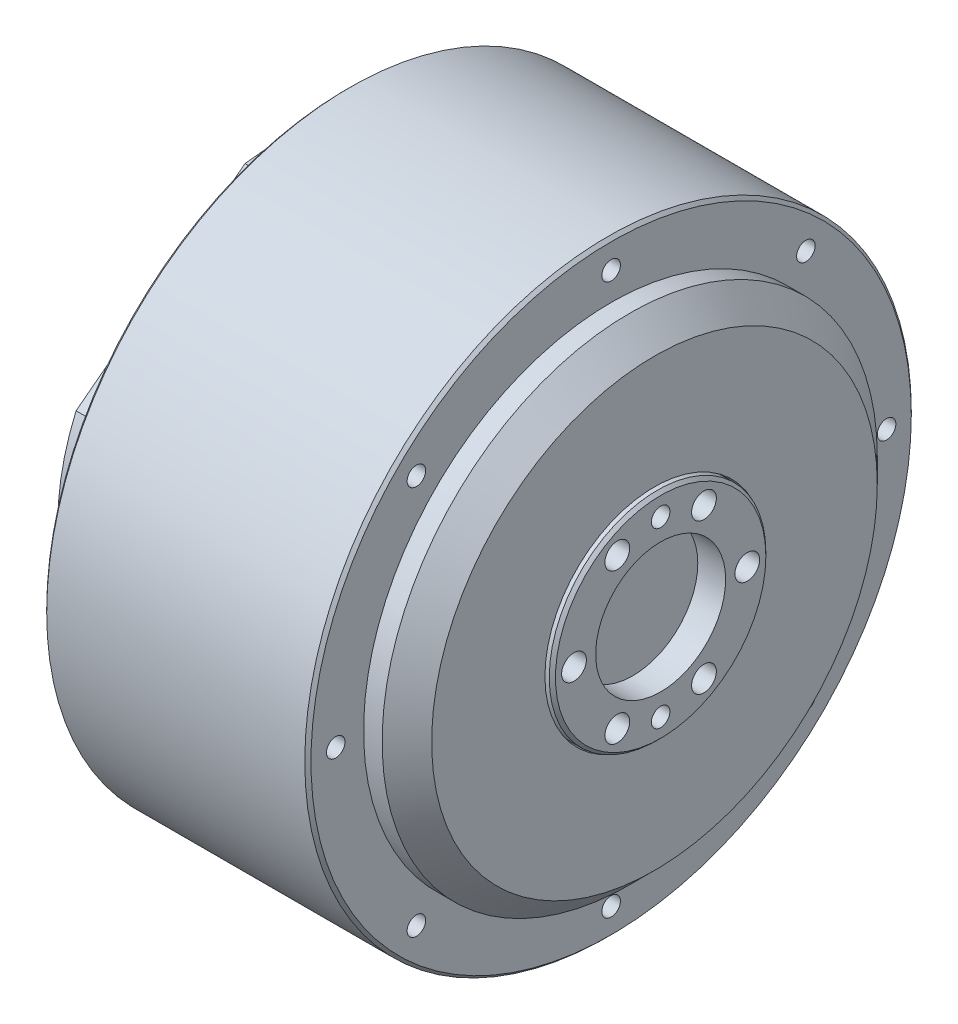
from build123d import *

# Parameters (mm, degrees)
SKETCH1_W                      = 42.7
SKETCH1_H                      = 49
SKETCH2_R                      = 35.5
BOSS_EXTRUDE1_DEPTH            = 11.2
CUT_EXTRUDE1_START             = -8
CUT_EXTRUDE1_DEPTH             = 8
SKETCH4_R                      = 40
BOSS_EXTRUDE2_DEPTH            = 3
SKETCH5_R                      = 40
BOSS_EXTRUDE3_DEPTH            = 4
BOSS_EXTRUDE3_TAPER            = 45.000000001
M33_CLEARANCE_HOLE1_D          = 35.4
M33_CLEARANCE_HOLE1_DEPTH      = 7.5
SKETCH8_W                      = 8.5
SKETCH8_H                      = 17.5
F_3_0_3_DIAMETER_HOLE1_D       = 3
F_3_0_3_DIAMETER_HOLE1_DEPTH   = 4
F_3_0_3_DIAMETER_HOLE2_D       = 3
F_3_0_3_DIAMETER_HOLE2_DEPTH   = 8
F_21_0_21_DIAMETER_HOLE1_D     = 21
F_21_0_21_DIAMETER_HOLE1_DEPTH = 4.5
F_4_0_4_DIAMETER_HOLE1_D       = 4
F_4_0_4_DIAMETER_HOLE1_DEPTH   = 8
F_3_0_3_DIAMETER_HOLE3_D       = 3
F_3_0_3_DIAMETER_HOLE3_DEPTH   = 3
CHAMFER1_SIZE                  = 0.5


with BuildPart() as part:
    # Sketch1 → Revolve1 (revolve)
    with BuildSketch(Plane.XY):
        with Locations((-29.35, 24.5)):
            Rectangle(SKETCH1_W, SKETCH1_H)
    revolve(axis=Axis((-50.7, 0, 0), (1, 0, 0)))

    # Sketch2 → Boss-Extrude1 (add)
    with BuildSketch(Plane.ZY.offset(50.7)):
        Circle(SKETCH2_R)
    extrude(amount=BOSS_EXTRUDE1_DEPTH)

    # Sketch3 → Cut-Extrude1 (cut)
    with BuildSketch(Plane.ZY.offset(61.9).offset(CUT_EXTRUDE1_START)):
        with BuildLine():
            Line((5.253044864, 35.109194233), (32.553289394, 14.160979826))
            ThreePointArc((32.553289394, 14.160979826), (21.61103073, 28.16404358), (5.253044864, 35.109194233))
        make_face()
    extrude(amount=CUT_EXTRUDE1_DEPTH, mode=Mode.SUBTRACT)

    # Sketch4 → Boss-Extrude2 (add)
    with BuildSketch(Plane(origin=(-8, 0, 0), x_dir=(0, 0, -1), z_dir=(1, 0, 0))):
        Circle(SKETCH4_R)
    extrude(amount=BOSS_EXTRUDE2_DEPTH)

    # Sketch5 → Boss-Extrude3 (add)
    with BuildSketch(Plane(origin=(-5, 0, 0), x_dir=(0, 0, -1), z_dir=(1, 0, 0))):
        Circle(SKETCH5_R)
    extrude(amount=BOSS_EXTRUDE3_DEPTH, taper=BOSS_EXTRUDE3_TAPER)

    # M33 Clearance Hole1
    with Locations(Plane(origin=(-1, 0, 0), x_dir=(0, 0, -1), z_dir=(1, 0, 0))):
        with Locations((0, 0)):
            Hole(M33_CLEARANCE_HOLE1_D / 2, depth=M33_CLEARANCE_HOLE1_DEPTH)

    # Sketch8 → Revolve2 (revolve)
    with BuildSketch(Plane.XY):
        with Locations((-4.25, 8.75)):
            Rectangle(SKETCH8_W, SKETCH8_H)
    revolve(axis=Axis((-8.5, 0, 0), (1, 0, 0)))

    # Ø3.0 (3) Diameter Hole1
    with Locations(Plane.ZY.offset(50.7)):
        with Locations((39.264880132, 16.264045876), (39.264880132, -16.264045876), (16.264045876, -39.264880132), (-16.264045876, -39.264880132), (-39.264880132, -16.264045876), (-39.264880132, 16.264045876), (-16.264045876, 39.264880132), (16.264045876, 39.264880132)):
            Hole(F_3_0_3_DIAMETER_HOLE1_D / 2, depth=F_3_0_3_DIAMETER_HOLE1_DEPTH)

    # Ø3.0 (3) Diameter Hole2
    with Locations(Plane(origin=(-8, 0, 0), x_dir=(0, 0, -1), z_dir=(1, 0, 0))):
        with Locations((31.466251763, 31.466251763), (44.5, 0), (31.466251763, -31.466251763), (0, -44.5), (-31.466251763, -31.466251763), (-44.5, 0), (-31.466251763, 31.466251763), (0, 44.5)):
            Hole(F_3_0_3_DIAMETER_HOLE2_D / 2, depth=F_3_0_3_DIAMETER_HOLE2_DEPTH)

    # Ø21.0 (21) Diameter Hole1
    with Locations(Plane(origin=(0, 0, 0), x_dir=(0, 0, -1), z_dir=(1, 0, 0))):
        with Locations((0, 0)):
            Hole(F_21_0_21_DIAMETER_HOLE1_D / 2, depth=F_21_0_21_DIAMETER_HOLE1_DEPTH)

    # Ø4.0 (4) Diameter Hole1
    with Locations(Plane(origin=(0, 0, 0), x_dir=(0, 0, -1), z_dir=(1, 0, 0))):
        with Locations((-14, 0), (-7, 12.124355653), (7, 12.124355653), (14, 0), (7, -12.124355653), (-7, -12.124355653)):
            Hole(F_4_0_4_DIAMETER_HOLE1_D / 2, depth=F_4_0_4_DIAMETER_HOLE1_DEPTH)

    # Ø3.0 (3) Diameter Hole3
    with Locations(Plane(origin=(0, 0, 0), x_dir=(0, 0, -1), z_dir=(1, 0, 0))):
        with Locations((0, -14), (0, 14)):
            Hole(F_3_0_3_DIAMETER_HOLE3_D / 2, depth=F_3_0_3_DIAMETER_HOLE3_DEPTH)

    # Chamfer1
    chamfer1_edges = [part.edges().sort_by_distance(p)[0] for p in [
        (-50.7, -49, 0),
        (0, -17.5, 0),
        (-8, -49, 0),
    ]]
    chamfer(chamfer1_edges, length=CHAMFER1_SIZE)


solid = part.part
